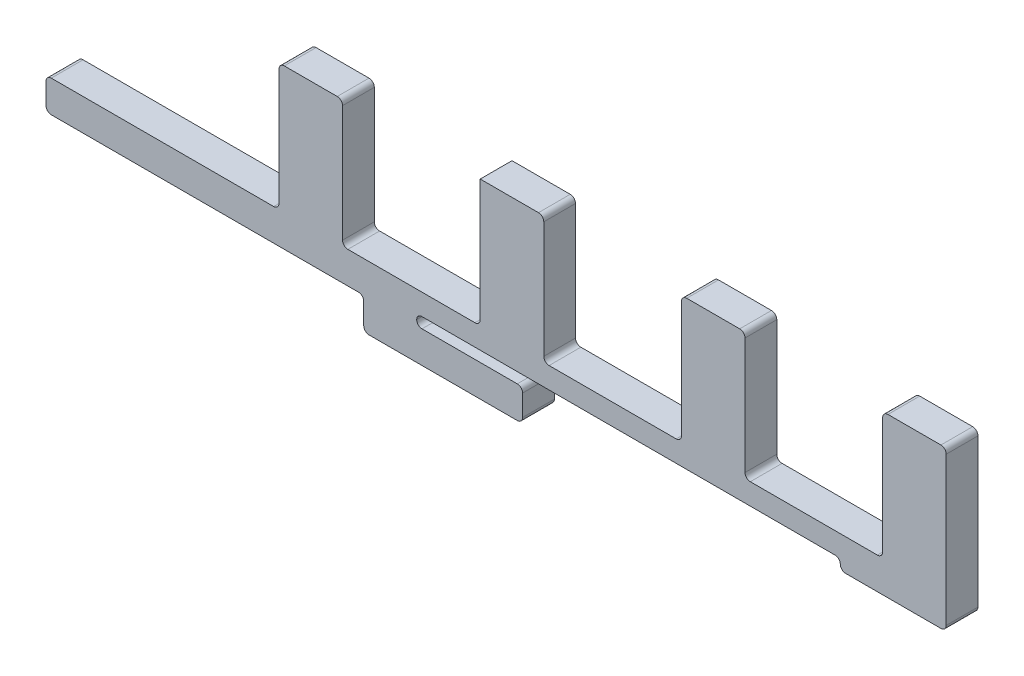
from build123d import *

# Parameters (mm, degrees)
BOSS_EXTRUDE1_DEPTH = 3
FILLET1_R           = 0.5


with BuildPart() as part:
    # Sketch1 → Boss-Extrude1 (new body)
    with BuildSketch(Plane.XY):
        Polygon((0, 0), (30, 0), (30, -3), (45, -3), (45, 0), (35, 0), (35, 1), (75, 1), (75, 0), (85, 0), (85, 15), (79, 15), (79, 3), (66, 3), (66, 15), (60, 15), (60, 3), (47, 3), (47, 15), (41, 15), (41, 3), (28, 3), (28, 15), (22, 15), (22, 3), (0, 3), align=None)
    extrude(amount=BOSS_EXTRUDE1_DEPTH)

    # Fillet1
    fillet1_edges = [part.edges().sort_by_distance(p)[0] for p in [
        (22, 3, 1.5),
        (22, 15, 1.5),
        (28, 15, 1.5),
        (28, 3, 1.5),
        (41, 3, 1.5),
        (47, 15, 1.5),
        (47, 3, 1.5),
        (66, 3, 1.5),
        (60, 3, 1.5),
        (60, 15, 1.5),
        (66, 15, 1.5),
        (79, 3, 1.5),
        (79, 15, 1.5),
        (85, 15, 1.5),
        (85, 0, 1.5),
        (75, 1, 1.5),
        (75, 0, 1.5),
        (0, 3, 1.5),
        (0, 0, 1.5),
        (30, 0, 1.5),
        (30, -3, 1.5),
        (45, -3, 1.5),
        (45, 0, 1.5),
        (35, 0, 1.5),
        (35, 1, 1.5),
    ]]
    fillet(fillet1_edges, radius=FILLET1_R - 0.0001)  # a hair under: the kernel refuses the full size


solid = part.part
